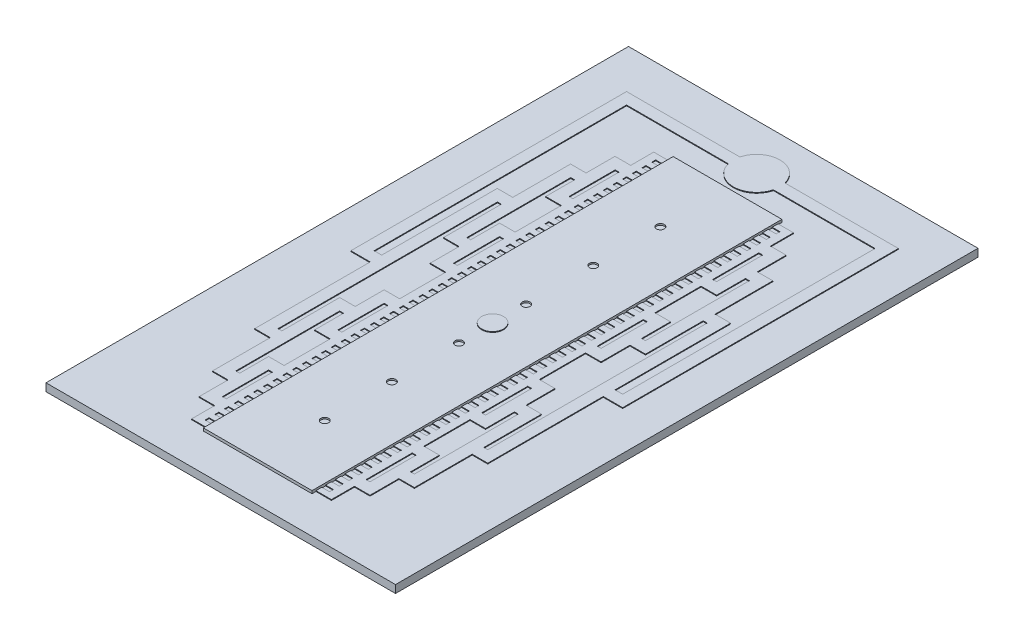
from build123d import *

# Parameters (mm, degrees)
SKETCH2_W           = 45
SKETCH2_H           = 75
BOSS_EXTRUDE1_DEPTH = 1
SKETCH3_W           = 14
SKETCH3_H           = 60.5
BOSS_EXTRUDE2_DEPTH = 0.35
SKETCH4_W           = 2
SKETCH4_H           = 59.5
BOSS_EXTRUDE3_DEPTH = 0.1
SKETCH5_W           = 1
SKETCH5_H           = 0.5
CUT_EXTRUDE1_DEPTH  = 0.1
BOSS_EXTRUDE4_DEPTH = 0.1
SKETCH7_R           = 1.4
BOSS_EXTRUDE5_DEPTH = 0.1
SKETCH8_R           = 0.5
CUT_EXTRUDE2_DEPTH  = 0.2
SKETCH9_W           = 45.00373836
SKETCH9_H           = 1
CUT_EXTRUDE3_DEPTH  = 2.5
SKETCH10_W          = 45.001662642
SKETCH10_H          = 1
BOSS_EXTRUDE6_DEPTH = 2.5


with BuildPart() as part:
    # Sketch2 → Boss-Extrude1 (new body)
    with BuildSketch(Plane(origin=(0, 0, 0), x_dir=(1, 0, 0), z_dir=(0, 1, 0))):
        Rectangle(SKETCH2_W, SKETCH2_H)
    extrude(amount=BOSS_EXTRUDE1_DEPTH)

    # Sketch3 → Boss-Extrude2 (add)
    with BuildSketch(Plane(origin=(0, 1, 0), x_dir=(1, 0, 0), z_dir=(0, 1, 0))):
        Rectangle(SKETCH3_W, SKETCH3_H)
    extrude(amount=BOSS_EXTRUDE2_DEPTH)

    # Sketch4 → Boss-Extrude3 (add)
    with BuildSketch(Plane(origin=(0, 1, 0), x_dir=(1, 0, 0), z_dir=(0, 1, 0))):
        with Locations((8, 0)):
            Rectangle(SKETCH4_W, SKETCH4_H)
        with Locations((-8, 0)):
            Rectangle(SKETCH4_W, SKETCH4_H)
    extrude(amount=BOSS_EXTRUDE3_DEPTH)

    # Sketch5 → Cut-Extrude1 (cut)
    with BuildSketch(Plane(origin=(0, 1.1, 0), x_dir=(1, 0, 0), z_dir=(0, 1, 0))):
        with Locations((7.5, 28.75)):
            Rectangle(SKETCH5_W, SKETCH5_H)
        with Locations((-7.5, 28.75)):
            Rectangle(SKETCH5_W, SKETCH5_H)
        with Locations((-7.5, 27.5)):
            Rectangle(SKETCH5_W, SKETCH5_H)
        with Locations((-7.5, 26.25)):
            Rectangle(SKETCH5_W, SKETCH5_H)
        with Locations((-7.5, 25)):
            Rectangle(SKETCH5_W, SKETCH5_H)
        with Locations((-7.5, 23.75)):
            Rectangle(SKETCH5_W, SKETCH5_H)
        with Locations((-7.5, 22.5)):
            Rectangle(SKETCH5_W, SKETCH5_H)
        with Locations((-7.5, 21.25)):
            Rectangle(SKETCH5_W, SKETCH5_H)
        with Locations((-7.5, 20)):
            Rectangle(SKETCH5_W, SKETCH5_H)
        with Locations((-7.5, 18.75)):
            Rectangle(SKETCH5_W, SKETCH5_H)
        with Locations((-7.5, 17.5)):
            Rectangle(SKETCH5_W, SKETCH5_H)
        with Locations((-7.5, 16.25)):
            Rectangle(SKETCH5_W, SKETCH5_H)
        with Locations((-7.5, 15)):
            Rectangle(SKETCH5_W, SKETCH5_H)
        with Locations((-7.5, 13.75)):
            Rectangle(SKETCH5_W, SKETCH5_H)
        with Locations((-7.5, 12.5)):
            Rectangle(SKETCH5_W, SKETCH5_H)
        with Locations((-7.5, 11.25)):
            Rectangle(SKETCH5_W, SKETCH5_H)
        with Locations((-7.5, 10)):
            Rectangle(SKETCH5_W, SKETCH5_H)
        with Locations((-7.5, 8.75)):
            Rectangle(SKETCH5_W, SKETCH5_H)
        with Locations((-7.5, 7.5)):
            Rectangle(SKETCH5_W, SKETCH5_H)
        with Locations((-7.5, 6.25)):
            Rectangle(SKETCH5_W, SKETCH5_H)
        with Locations((-7.5, 5)):
            Rectangle(SKETCH5_W, SKETCH5_H)
        with Locations((-7.5, 3.75)):
            Rectangle(SKETCH5_W, SKETCH5_H)
        with Locations((-7.5, 2.5)):
            Rectangle(SKETCH5_W, SKETCH5_H)
        with Locations((-7.5, 1.25)):
            Rectangle(SKETCH5_W, SKETCH5_H)
        with Locations((-7.5, 0)):
            Rectangle(SKETCH5_W, SKETCH5_H)
        with Locations((-7.5, -1.25)):
            Rectangle(SKETCH5_W, SKETCH5_H)
        with Locations((-7.5, -2.5)):
            Rectangle(SKETCH5_W, SKETCH5_H)
        with Locations((-7.5, -3.75)):
            Rectangle(SKETCH5_W, SKETCH5_H)
        with Locations((-7.5, -5)):
            Rectangle(SKETCH5_W, SKETCH5_H)
        with Locations((-7.5, -6.25)):
            Rectangle(SKETCH5_W, SKETCH5_H)
        with Locations((-7.5, -7.5)):
            Rectangle(SKETCH5_W, SKETCH5_H)
        with Locations((-7.5, -8.75)):
            Rectangle(SKETCH5_W, SKETCH5_H)
        with Locations((-7.5, -10)):
            Rectangle(SKETCH5_W, SKETCH5_H)
        with Locations((-7.5, -11.25)):
            Rectangle(SKETCH5_W, SKETCH5_H)
        with Locations((-7.5, -12.5)):
            Rectangle(SKETCH5_W, SKETCH5_H)
        with Locations((-7.5, -13.75)):
            Rectangle(SKETCH5_W, SKETCH5_H)
        with Locations((-7.5, -15)):
            Rectangle(SKETCH5_W, SKETCH5_H)
        with Locations((-7.5, -16.25)):
            Rectangle(SKETCH5_W, SKETCH5_H)
        with Locations((-7.5, -17.5)):
            Rectangle(SKETCH5_W, SKETCH5_H)
        with Locations((-7.5, -18.75)):
            Rectangle(SKETCH5_W, SKETCH5_H)
        with Locations((-7.5, -20)):
            Rectangle(SKETCH5_W, SKETCH5_H)
        with Locations((-7.5, -21.25)):
            Rectangle(SKETCH5_W, SKETCH5_H)
        with Locations((-7.5, -22.5)):
            Rectangle(SKETCH5_W, SKETCH5_H)
        with Locations((-7.5, -23.75)):
            Rectangle(SKETCH5_W, SKETCH5_H)
        with Locations((-7.5, -25)):
            Rectangle(SKETCH5_W, SKETCH5_H)
        with Locations((-7.5, -26.25)):
            Rectangle(SKETCH5_W, SKETCH5_H)
        with Locations((-7.5, -27.5)):
            Rectangle(SKETCH5_W, SKETCH5_H)
        with Locations((-7.5, -28.75)):
            Rectangle(SKETCH5_W, SKETCH5_H)
        with Locations((7.5, 27.5)):
            Rectangle(SKETCH5_W, SKETCH5_H)
        with Locations((7.5, 26.25)):
            Rectangle(SKETCH5_W, SKETCH5_H)
        with Locations((7.5, 25)):
            Rectangle(SKETCH5_W, SKETCH5_H)
        with Locations((7.5, 23.75)):
            Rectangle(SKETCH5_W, SKETCH5_H)
        with Locations((7.5, 22.5)):
            Rectangle(SKETCH5_W, SKETCH5_H)
        with Locations((7.5, 21.25)):
            Rectangle(SKETCH5_W, SKETCH5_H)
        with Locations((7.5, 20)):
            Rectangle(SKETCH5_W, SKETCH5_H)
        with Locations((7.5, 18.75)):
            Rectangle(SKETCH5_W, SKETCH5_H)
        with Locations((7.5, 17.5)):
            Rectangle(SKETCH5_W, SKETCH5_H)
        with Locations((7.5, 16.25)):
            Rectangle(SKETCH5_W, SKETCH5_H)
        with Locations((7.5, 15)):
            Rectangle(SKETCH5_W, SKETCH5_H)
        with Locations((7.5, 13.75)):
            Rectangle(SKETCH5_W, SKETCH5_H)
        with Locations((7.5, 12.5)):
            Rectangle(SKETCH5_W, SKETCH5_H)
        with Locations((7.5, 11.25)):
            Rectangle(SKETCH5_W, SKETCH5_H)
        with Locations((7.5, 10)):
            Rectangle(SKETCH5_W, SKETCH5_H)
        with Locations((7.5, 8.75)):
            Rectangle(SKETCH5_W, SKETCH5_H)
        with Locations((7.5, 7.5)):
            Rectangle(SKETCH5_W, SKETCH5_H)
        with Locations((7.5, 6.25)):
            Rectangle(SKETCH5_W, SKETCH5_H)
        with Locations((7.5, 5)):
            Rectangle(SKETCH5_W, SKETCH5_H)
        with Locations((7.5, 3.75)):
            Rectangle(SKETCH5_W, SKETCH5_H)
        with Locations((7.5, 2.5)):
            Rectangle(SKETCH5_W, SKETCH5_H)
        with Locations((7.5, 1.25)):
            Rectangle(SKETCH5_W, SKETCH5_H)
        with Locations((7.5, 0)):
            Rectangle(SKETCH5_W, SKETCH5_H)
        with Locations((7.5, -1.25)):
            Rectangle(SKETCH5_W, SKETCH5_H)
        with Locations((7.5, -2.5)):
            Rectangle(SKETCH5_W, SKETCH5_H)
        with Locations((7.5, -3.75)):
            Rectangle(SKETCH5_W, SKETCH5_H)
        with Locations((7.5, -5)):
            Rectangle(SKETCH5_W, SKETCH5_H)
        with Locations((7.5, -6.25)):
            Rectangle(SKETCH5_W, SKETCH5_H)
        with Locations((7.5, -7.5)):
            Rectangle(SKETCH5_W, SKETCH5_H)
        with Locations((7.5, -8.75)):
            Rectangle(SKETCH5_W, SKETCH5_H)
        with Locations((7.5, -10)):
            Rectangle(SKETCH5_W, SKETCH5_H)
        with Locations((7.5, -11.25)):
            Rectangle(SKETCH5_W, SKETCH5_H)
        with Locations((7.5, -12.5)):
            Rectangle(SKETCH5_W, SKETCH5_H)
        with Locations((7.5, -13.75)):
            Rectangle(SKETCH5_W, SKETCH5_H)
        with Locations((7.5, -15)):
            Rectangle(SKETCH5_W, SKETCH5_H)
        with Locations((7.5, -16.25)):
            Rectangle(SKETCH5_W, SKETCH5_H)
        with Locations((7.5, -17.5)):
            Rectangle(SKETCH5_W, SKETCH5_H)
        with Locations((7.5, -18.75)):
            Rectangle(SKETCH5_W, SKETCH5_H)
        with Locations((7.5, -20)):
            Rectangle(SKETCH5_W, SKETCH5_H)
        with Locations((7.5, -21.25)):
            Rectangle(SKETCH5_W, SKETCH5_H)
        with Locations((7.5, -22.5)):
            Rectangle(SKETCH5_W, SKETCH5_H)
        with Locations((7.5, -23.75)):
            Rectangle(SKETCH5_W, SKETCH5_H)
        with Locations((7.5, -25)):
            Rectangle(SKETCH5_W, SKETCH5_H)
        with Locations((7.5, -26.25)):
            Rectangle(SKETCH5_W, SKETCH5_H)
        with Locations((7.5, -27.5)):
            Rectangle(SKETCH5_W, SKETCH5_H)
        with Locations((7.5, -28.75)):
            Rectangle(SKETCH5_W, SKETCH5_H)
    extrude(amount=-CUT_EXTRUDE1_DEPTH, mode=Mode.SUBTRACT)

    # Sketch6 → Boss-Extrude4 (add)
    with BuildSketch(Plane(origin=(0, 1, 0), x_dir=(1, 0, 0), z_dir=(0, 1, 0))):
        with BuildLine():
            Line((-2.90473751, 34.75), (-17.5, 34.75))
            Line((-17.5, 34.75), (-17.5, -0.75))
            Line((-17.5, -0.75), (-15, -0.75))
            Line((-15, -0.75), (-15, -15.625))
            Line((-15, -15.625), (-13, -15.625))
            Line((-13, -15.625), (-13, -23.0625))
            Line((-13, -23.0625), (-11, -23.0625))
            Line((-11, -23.0625), (-11, -26.78125))
            Line((-11, -26.78125), (-9, -26.78125))
            Line((-9, -26.78125), (-9, -25.28125))
            Line((-9, -25.28125), (-9.5, -25.28125))
            Line((-9.5, -25.28125), (-9.5, -19.34375))
            Line((-9.5, -19.34375), (-9, -19.34375))
            Line((-9, -19.34375), (-9, -17.84375))
            Line((-9, -17.84375), (-11, -17.84375))
            Line((-11, -17.84375), (-11, -21.5625))
            Line((-11, -21.5625), (-11.5, -21.5625))
            Line((-11.5, -21.5625), (-11.5, -8.1875))
            Line((-11.5, -8.1875), (-11, -8.1875))
            Line((-11, -8.1875), (-11, -11.90625))
            Line((-11, -11.90625), (-9, -11.90625))
            Line((-9, -11.90625), (-9, -10.40625))
            Line((-9, -10.40625), (-9.5, -10.40625))
            Line((-9.5, -10.40625), (-9.5, -4.46875))
            Line((-9.5, -4.46875), (-9, -4.46875))
            Line((-9, -4.46875), (-9, -2.96875))
            Line((-9, -2.96875), (-11, -2.96875))
            Line((-11, -2.96875), (-11, -6.6875))
            Line((-11, -6.6875), (-13, -6.6875))
            Line((-13, -6.6875), (-13, -14.125))
            Line((-13, -14.125), (-13.5, -14.125))
            Line((-13.5, -14.125), (-13.5, 14.125))
            Line((-13.5, 14.125), (-13, 14.125))
            Line((-13, 14.125), (-13, 6.6875))
            Line((-13, 6.6875), (-11, 6.6875))
            Line((-11, 6.6875), (-11, 2.96875))
            Line((-11, 2.96875), (-9, 2.96875))
            Line((-9, 2.96875), (-9, 4.46875))
            Line((-9, 4.46875), (-9.5, 4.46875))
            Line((-9.5, 4.46875), (-9.5, 10.40625))
            Line((-9.5, 10.40625), (-9, 10.40625))
            Line((-9, 10.40625), (-9, 11.90625))
            Line((-9, 11.90625), (-11, 11.90625))
            Line((-11, 11.90625), (-11, 8.1875))
            Line((-11, 8.1875), (-11.5, 8.1875))
            Line((-11.5, 8.1875), (-11.5, 21.5625))
            Line((-11.5, 21.5625), (-11, 21.5625))
            Line((-11, 21.5625), (-11, 17.84375))
            Line((-11, 17.84375), (-9, 17.84375))
            Line((-9, 17.84375), (-9, 19.34375))
            Line((-9, 19.34375), (-9.5, 19.34375))
            Line((-9.5, 19.34375), (-9.5, 25.28125))
            Line((-9.5, 25.28125), (-9, 25.28125))
            Line((-9, 25.28125), (-9, 26.78125))
            Line((-9, 26.78125), (-11.022930545, 26.78125))
            Line((-11.022930545, 26.78125), (-11.022930545, 23.0625))
            Line((-11.022930545, 23.0625), (-13.022930545, 23.0625))
            Line((-13.022930545, 23.0625), (-13.022930545, 15.625))
            Line((-13.022930545, 15.625), (-15.022930545, 15.625))
            Line((-15.022930545, 15.625), (-15.022930545, 0.75))
            Line((-15.022930545, 0.75), (-16, 0.75))
            Line((-16, 0.75), (-16, 33.25))
            Line((-16, 33.25), (-2.90473751, 33.25))
            ThreePointArc((-2.90473751, 33.25), (0, 31), (2.90473751, 33.25))
            Line((2.90473751, 33.25), (16, 33.25))
            Line((16, 33.25), (16, 0.75))
            Line((16, 0.75), (15.022930545, 0.75))
            Line((15.022930545, 0.75), (15.022930545, 15.625))
            Line((15.022930545, 15.625), (13.022930545, 15.625))
            Line((13.022930545, 15.625), (13.022930545, 23.0625))
            Line((13.022930545, 23.0625), (11.022930545, 23.0625))
            Line((11.022930545, 23.0625), (11.022930545, 26.78125))
            Line((11.022930545, 26.78125), (9, 26.78125))
            Line((9, 26.78125), (9, 25.28125))
            Line((9, 25.28125), (9.5, 25.28125))
            Line((9.5, 25.28125), (9.5, 19.34375))
            Line((9.5, 19.34375), (9, 19.34375))
            Line((9, 19.34375), (9, 17.84375))
            Line((9, 17.84375), (11, 17.84375))
            Line((11, 17.84375), (11, 21.5625))
            Line((11, 21.5625), (11.5, 21.5625))
            Line((11.5, 21.5625), (11.5, 8.1875))
            Line((11.5, 8.1875), (11, 8.1875))
            Line((11, 8.1875), (11, 11.90625))
            Line((11, 11.90625), (9, 11.90625))
            Line((9, 11.90625), (9, 10.40625))
            Line((9, 10.40625), (9.5, 10.40625))
            Line((9.5, 10.40625), (9.5, 4.46875))
            Line((9.5, 4.46875), (9, 4.46875))
            Line((9, 4.46875), (9, 2.96875))
            Line((9, 2.96875), (11, 2.96875))
            Line((11, 2.96875), (11, 6.6875))
            Line((11, 6.6875), (13, 6.6875))
            Line((13, 6.6875), (13, 14.125))
            Line((13, 14.125), (13.5, 14.125))
            Line((13.5, 14.125), (13.5, -14.125))
            Line((13.5, -14.125), (13, -14.125))
            Line((13, -14.125), (13, -6.6875))
            Line((13, -6.6875), (11, -6.6875))
            Line((11, -6.6875), (11, -2.96875))
            Line((11, -2.96875), (9, -2.96875))
            Line((9, -2.96875), (9, -4.46875))
            Line((9, -4.46875), (9.5, -4.46875))
            Line((9.5, -4.46875), (9.5, -10.40625))
            Line((9.5, -10.40625), (9, -10.40625))
            Line((9, -10.40625), (9, -11.90625))
            Line((9, -11.90625), (11, -11.90625))
            Line((11, -11.90625), (11, -8.1875))
            Line((11, -8.1875), (11.5, -8.1875))
            Line((11.5, -8.1875), (11.5, -21.5625))
            Line((11.5, -21.5625), (11, -21.5625))
            Line((11, -21.5625), (11, -17.84375))
            Line((11, -17.84375), (9, -17.84375))
            Line((9, -17.84375), (9, -19.34375))
            Line((9, -19.34375), (9.5, -19.34375))
            Line((9.5, -19.34375), (9.5, -25.28125))
            Line((9.5, -25.28125), (9, -25.28125))
            Line((9, -25.28125), (9, -26.78125))
            Line((9, -26.78125), (11, -26.78125))
            Line((11, -26.78125), (11, -23.0625))
            Line((11, -23.0625), (13, -23.0625))
            Line((13, -23.0625), (13, -15.625))
            Line((13, -15.625), (15, -15.625))
            Line((15, -15.625), (15, -0.75))
            Line((15, -0.75), (17.5, -0.75))
            Line((17.5, -0.75), (17.5, 34.75))
            Line((17.5, 34.75), (2.90473751, 34.75))
            ThreePointArc((2.90473751, 34.75), (0, 37), (-2.90473751, 34.75))
        make_face()
    extrude(amount=BOSS_EXTRUDE4_DEPTH)

    # Sketch7 → Boss-Extrude5 (add)
    with BuildSketch(Plane(origin=(0, 1.35, 0), x_dir=(1, 0, 0), z_dir=(0, 1, 0))):
        Circle(SKETCH7_R)
    extrude(amount=BOSS_EXTRUDE5_DEPTH)

    # Sketch8 → Cut-Extrude2 (cut)
    with BuildSketch(Plane(origin=(0, 1.35, 0), x_dir=(1, 0, 0), z_dir=(0, 1, 0))):
        with Locations((0, 21.60714286)):
            Circle(SKETCH8_R)
        with Locations((0, 12.96428572)):
            Circle(SKETCH8_R)
        with Locations((0, 4.32142858)):
            Circle(SKETCH8_R)
        with Locations((0, -4.32142856)):
            Circle(SKETCH8_R)
        with Locations((0, -12.9642857)):
            Circle(SKETCH8_R)
        with Locations((0, -21.60714284)):
            Circle(SKETCH8_R)
    extrude(amount=-CUT_EXTRUDE2_DEPTH, mode=Mode.SUBTRACT)

    # Sketch9 → Cut-Extrude3 (cut)
    with BuildSketch(Plane.XY.offset(37.5)):
        with Locations((-0.00186918, 0.5)):
            Rectangle(SKETCH9_W, SKETCH9_H)
    extrude(amount=-CUT_EXTRUDE3_DEPTH, mode=Mode.SUBTRACT)

    # Sketch10 → Boss-Extrude6 (add)
    with BuildSketch(Plane(origin=(0, 0, -37.5), x_dir=(-1, 0, 0), z_dir=(0, 0, -1))):
        with Locations((0.000831321, 0.5)):
            Rectangle(SKETCH10_W, SKETCH10_H)
    extrude(amount=BOSS_EXTRUDE6_DEPTH)


solid = part.part
